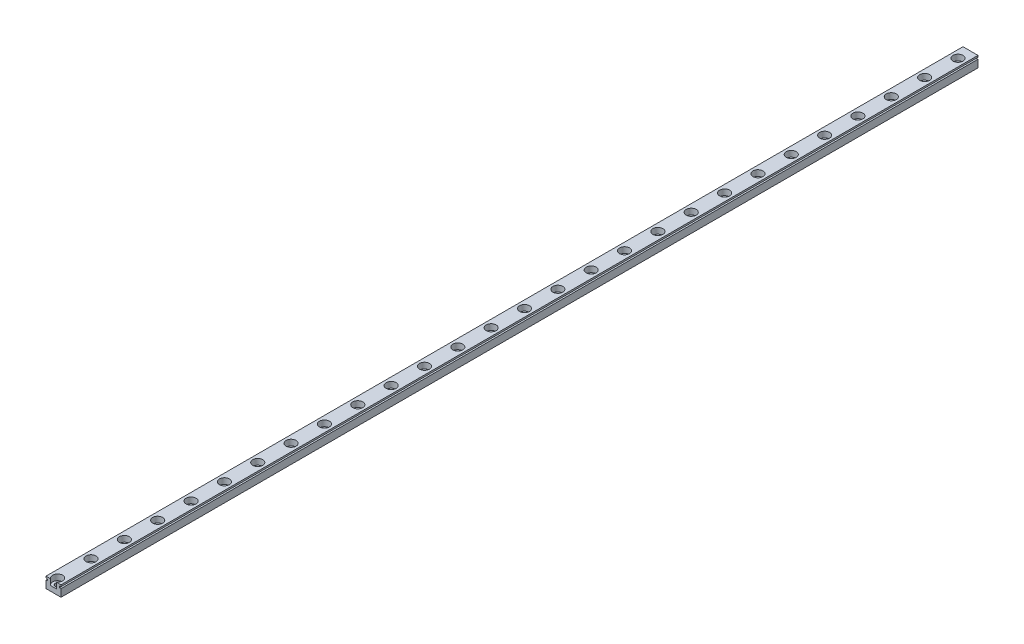
from build123d import *

# Parameters (mm, degrees)
EXTRUDE_1_DEPTH        = 550
PATTERN_LINEAR_1_COUNT = 28
PATTERN_LINEAR_1_PITCH = 20


with BuildPart() as part:
    # 草图1 → 凸台-拉伸1 (new body)
    with BuildSketch(Plane.XY):
        Polygon((-4.5, 0), (4.5, 0), (4.5, 4.5), (3.5, 4.5), (3.5, 5.5), (4.5, 5.5), (4.5, 6.5), (-4.5, 6.5), (-4.5, 5.5), (-3.5, 5.5), (-3.5, 4.5), (-4.5, 4.5), align=None)
    extrude(amount=EXTRUDE_1_DEPTH)

    # 草图2 → 切除-旋转1 (revolve, cut)
    with BuildSketch(Plane(origin=(0, 0, 0), x_dir=(0, 0, -1), z_dir=(1, 0, 0))):
        Polygon((-7.5, 0), (-6, 0), (-6, 3), (-4.5, 3), (-4.5, 6.5), (-7.5, 6.5), align=None)
    cut_revolve_1 = revolve(axis=Axis((0, 7.615907336, 7.5), (0, -1, 0)), mode=Mode.SUBTRACT)

    # 阵列(线性)1: 切除-旋转1 ×28
    with Locations(*[(0, 0, i * PATTERN_LINEAR_1_PITCH) for i in range(1, PATTERN_LINEAR_1_COUNT)]):
        add(cut_revolve_1, mode=Mode.SUBTRACT)


solid = part.part
